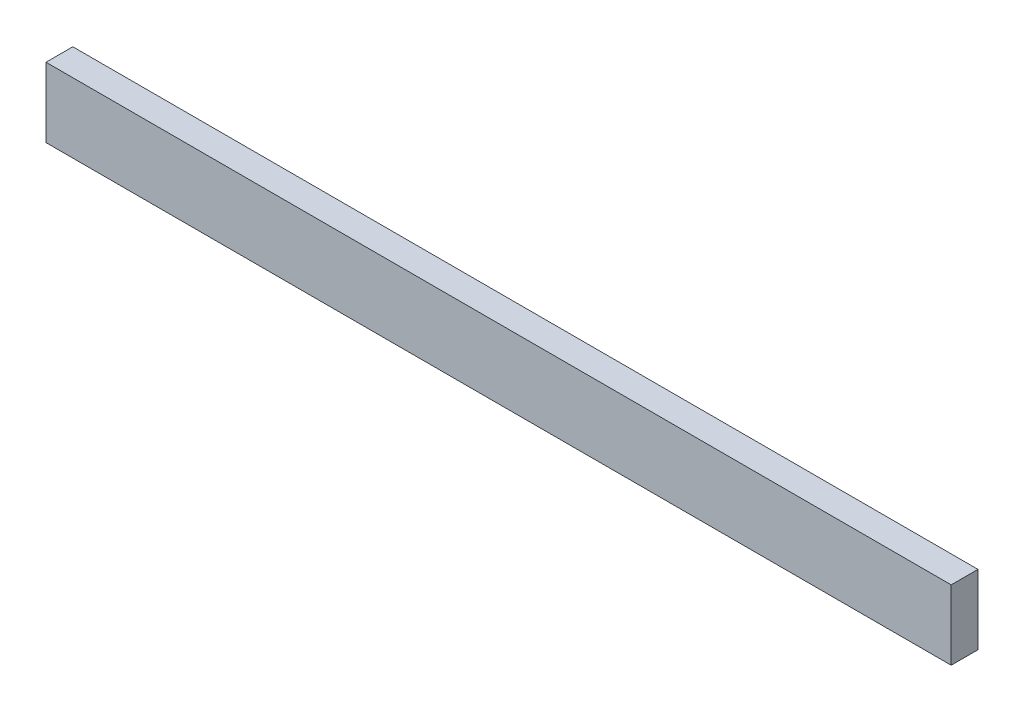
from build123d import *

# Parameters (mm, degrees)
SKETCH1_W           = 130
SKETCH1_H           = 10
BOSS_EXTRUDE1_DEPTH = 3.85


with BuildPart() as part:
    # Sketch1 → Boss-Extrude1 (new body)
    with BuildSketch(Plane.XY):
        Rectangle(SKETCH1_W, SKETCH1_H)
    extrude(amount=BOSS_EXTRUDE1_DEPTH)


solid = part.part
